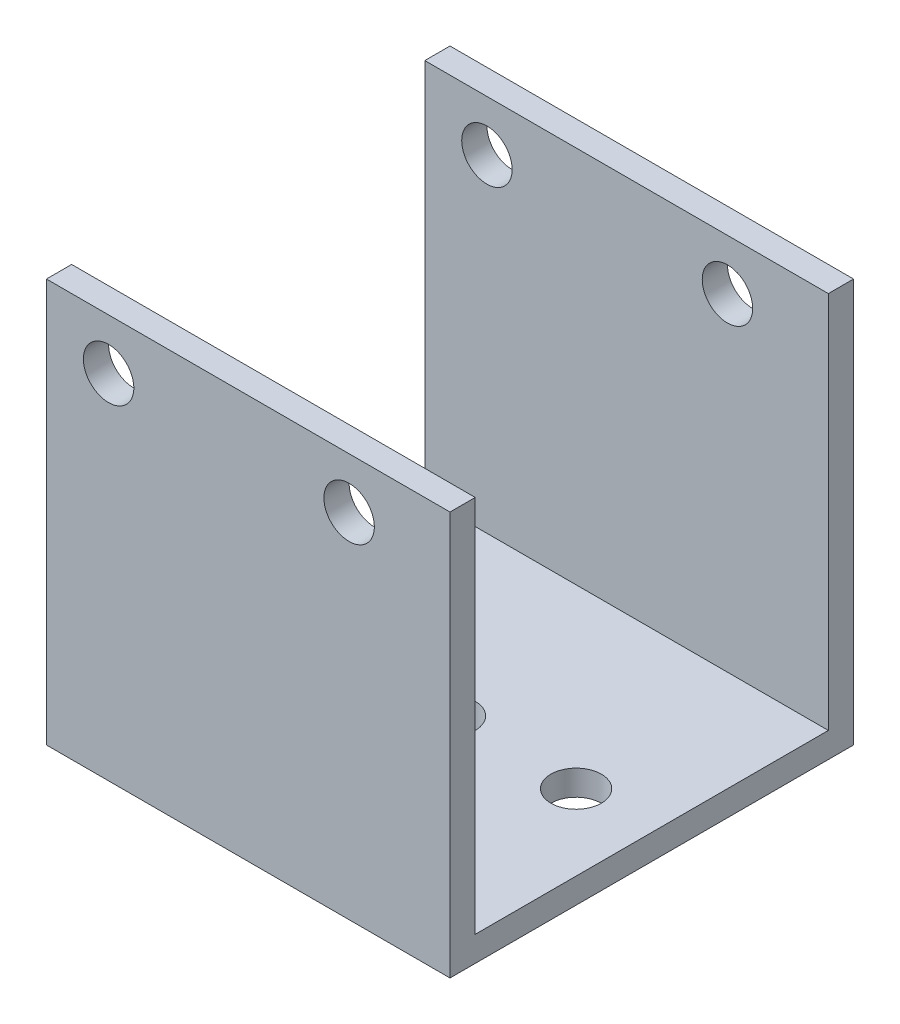
from build123d import *

# Parameters (mm, degrees)
BOSS_EXTRUDE1_DEPTH = 50.8
SKETCH2_R           = 3.175
CUT_EXTRUDE1_DEPTH  = 50.8
SKETCH6_R           = 3.175
CUT_EXTRUDE2_DEPTH  = 50.8


with BuildPart() as part:
    # Sketch1 → Boss-Extrude1 (new body)
    with BuildSketch(Plane(origin=(0, 0, 0), x_dir=(0, 0, -1), z_dir=(1, 0, 0))):
        Polygon((-29.265887299, 19.069791765), (-29.265887299, -31.730208235), (21.534112701, -31.730208235), (21.534112701, 19.069791765), (18.359112701, 19.069791765), (18.359112701, -28.555208235), (-26.090887299, -28.555208235), (-26.090887299, 19.069791765), align=None)
    extrude(amount=BOSS_EXTRUDE1_DEPTH)

    # Sketch2 → Cut-Extrude1 (cut)
    with BuildSketch(Plane(origin=(0, 0, -21.534112701), x_dir=(-1, 0, 0), z_dir=(0, 0, -1))):
        with Locations((-38.1, 12.680491765)):
            Circle(SKETCH2_R)
        with Locations((-7.8232, 12.680491765)):
            Circle(SKETCH2_R)
    extrude(amount=-CUT_EXTRUDE1_DEPTH, mode=Mode.SUBTRACT)

    # Sketch6 → Cut-Extrude2 (cut)
    with BuildSketch(Plane.XZ.offset(31.730208235)):
        with Locations((41.275, 3.865887299)):
            Circle(SKETCH6_R)
        with Locations((25.4, 3.865887299)):
            Circle(SKETCH6_R)
        with Locations((9.525, 3.865887299)):
            Circle(SKETCH6_R)
    extrude(amount=-CUT_EXTRUDE2_DEPTH, mode=Mode.SUBTRACT)


solid = part.part
